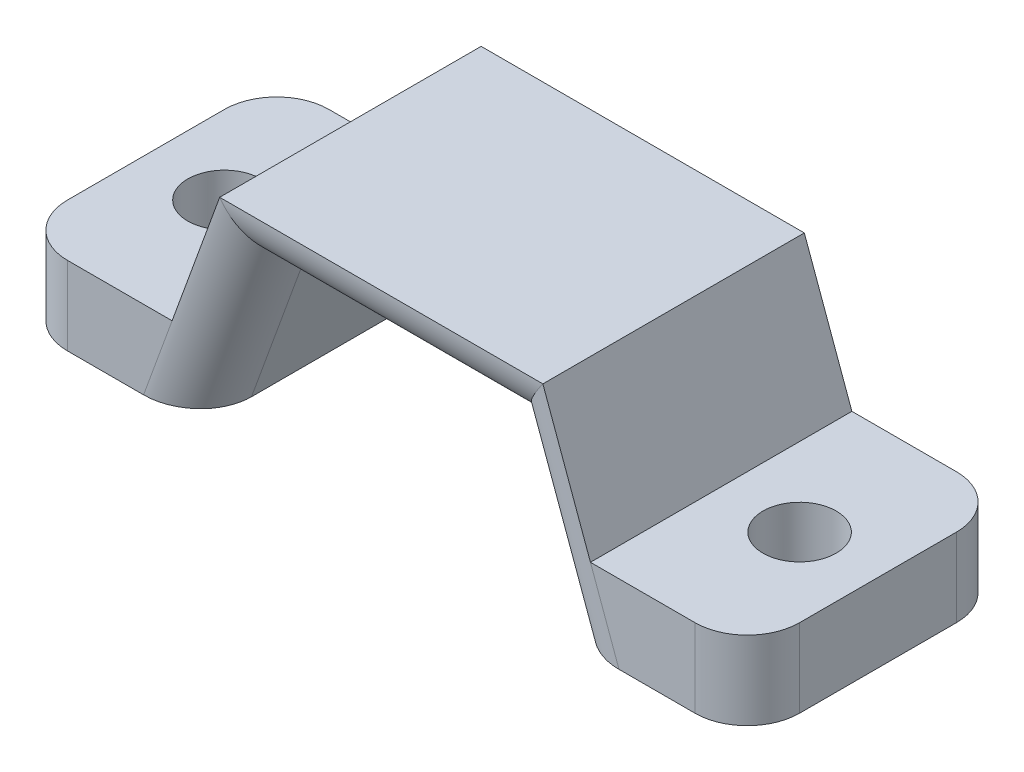
from build123d import *

# Parameters (mm, degrees)
BOSS_EXTRUDE1_DEPTH = 5
CUT_EXTRUDE1_REACH  = 18.882
SKETCH2_R           = 1.4
FILLET1_R           = 2
FILLET2_R           = 2


with BuildPart() as part:
    # Sketch1 → Boss-Extrude1 (new, symmetric)
    with BuildSketch(Plane.XY):
        Polygon((-14, 0), (-6.963555158, 0), (-4.779733752, 6), (4.779733752, 6), (6.963555158, 0), (14, 0), (14, 3), (8, 3), (6.180148829, 8), (-6.180148829, 8), (-8, 3), (-14, 3), align=None)
    extrude(amount=BOSS_EXTRUDE1_DEPTH, both=True)

    # Sketch2 → Cut-Extrude1 (cut, up to next)
    with BuildSketch(Plane.XZ, mode=Mode.PRIVATE) as cut_extrude1_sk1:
        with Locations(Location((-11, 0, 0), (0, 0, 270))):
            Circle(SKETCH2_R)
    cut_extrude1_tool1 = extrude(cut_extrude1_sk1.sketch, amount=-CUT_EXTRUDE1_REACH, mode=Mode.PRIVATE) & part.part
    # Sketch2 → Cut-Extrude1 (cut, up to next)
    with BuildSketch(Plane.XZ, mode=Mode.PRIVATE) as cut_extrude1_sk2:
        with Locations(Location((11, 0, 0), (0, 0, 270))):
            Circle(SKETCH2_R)
    cut_extrude1_tool2 = extrude(cut_extrude1_sk2.sketch, amount=-CUT_EXTRUDE1_REACH, mode=Mode.PRIVATE) & part.part
    add(cut_extrude1_tool1.solids().sort_by_distance((-11, 0, 0))[0], mode=Mode.SUBTRACT)
    add(cut_extrude1_tool2.solids().sort_by_distance((11, 0, 0))[0], mode=Mode.SUBTRACT)

    # Fillet1
    fillet1_edges = [part.edges().sort_by_distance(p)[0] for p in [
        (-5.871644455, 3, 5),
        (5.871644455, 3, -5),
        (0, 6, -5),
        (-5.871644455, 3, -5),
        (0, 6, 5),
        (5.871644455, 3, 5),
    ]]
    fillet(fillet1_edges, radius=FILLET1_R - 0.0001)  # a hair under: the kernel refuses the full size

    # Fillet2
    fillet2_edges = [part.edges().sort_by_distance(p)[0] for p in [
        (14, 1.5, -5),
        (-14, 1.5, -5),
        (14, 1.5, 5),
        (-14, 1.5, 5),
    ]]
    fillet(fillet2_edges, radius=FILLET2_R)


solid = part.part
